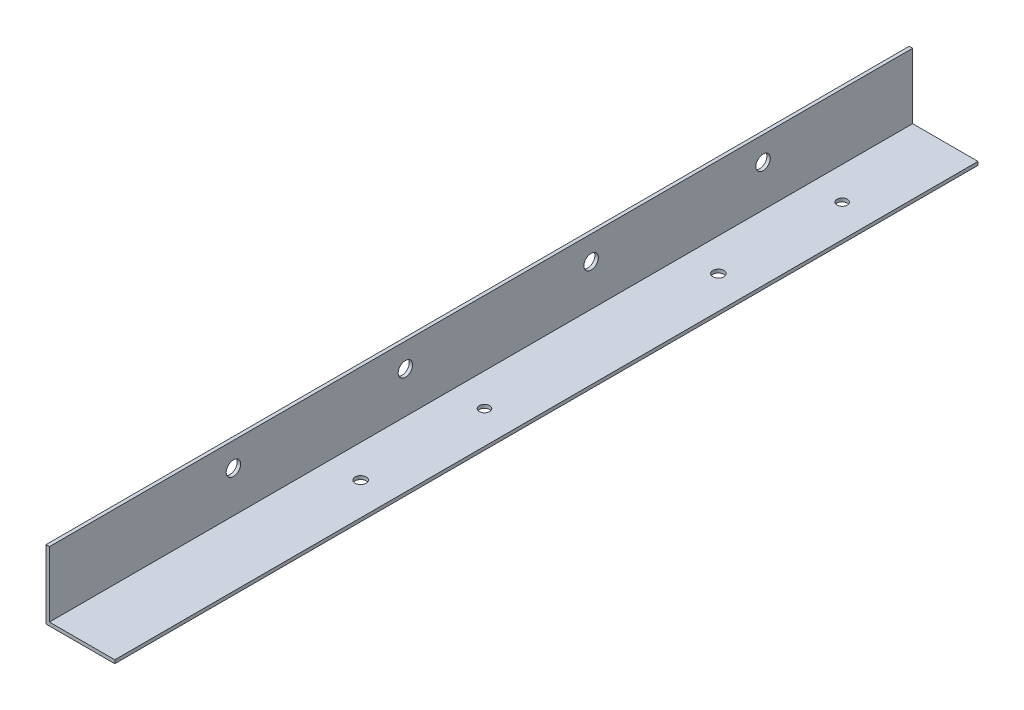
from build123d import *

# Parameters (mm, degrees)
EXTRUDE_1_DEPTH     = 251
SKETCH_3_R          = 1.5
SKETCH_3_R_2        = 1.6
CUT_EXTRUDE_1_DEPTH = 253.511385882
SKETCH_4_R          = 2.1
CUT_EXTRUDE_2_DEPTH = 253.588598318


with BuildPart() as part:
    # Эскиз1 → Бобышка-Вытянуть1 (new body)
    with BuildSketch(Plane.XY):
        Polygon((0, 0), (0, 20), (1, 20), (1, 1), (20, 1), (20, 0), align=None)
    extrude(amount=EXTRUDE_1_DEPTH)

    # Эскиз3 → Вырез-Вытянуть1 (cut, through all)
    with BuildSketch(Plane(origin=(0, 1, 0), x_dir=(1, 0, 0), z_dir=(0, 1, 0))):
        with Locations((10.5, -134)):
            Circle(SKETCH_3_R)
        with Locations((10.5, -170)):
            Circle(SKETCH_3_R_2)
        with Locations((10.5, -66)):
            Circle(SKETCH_3_R_2)
        with Locations((10.5, -30)):
            Circle(SKETCH_3_R)
    extrude(amount=-CUT_EXTRUDE_1_DEPTH, mode=Mode.SUBTRACT)

    # Эскиз4 → Вырез-Вытянуть2 (cut, through all)
    with BuildSketch(Plane.ZY):
        with Locations((43.5, 13)):
            Circle(SKETCH_4_R)
        with Locations((93.5, 13)):
            Circle(SKETCH_4_R)
        with Locations((147.5, 13)):
            Circle(SKETCH_4_R)
        with Locations((197.5, 13)):
            Circle(SKETCH_4_R)
    extrude(amount=-CUT_EXTRUDE_2_DEPTH, mode=Mode.SUBTRACT)


solid = part.part
